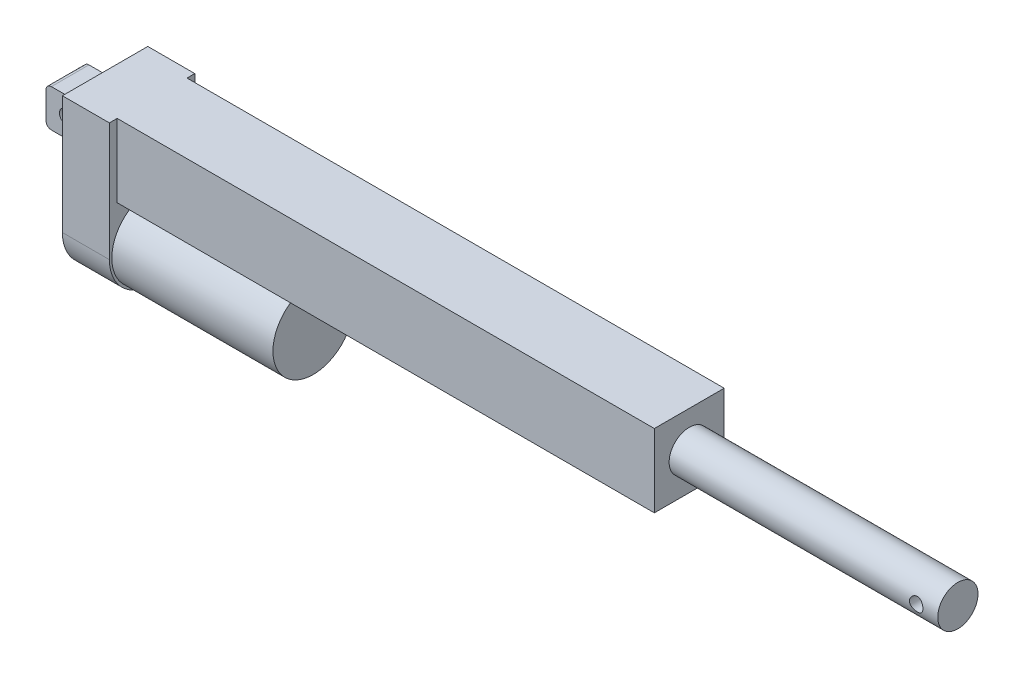
from build123d import *

# Parameters (mm, degrees)
SKETCH1_R               = 9.525
BOSS_EXTRUDE1_DEPTH     = 127
CUT_EXTRUDE1_DEPTH      = 128.712377043
CUT_EXTRUDE1_DEPTH_BACK = 128.712377043
SKETCH2_R               = 3.175
SKETCH3_W               = 33.02
SKETCH3_H               = 34.544
BOSS_EXTRUDE2_DEPTH     = 254
BOSS_EXTRUDE3_DEPTH     = 22.225
SKETCH5_R               = 19.05
BOSS_EXTRUDE4_DEPTH     = 76.2
SKETCH6_W               = 19.05
SKETCH6_H               = 17.78
SKETCH6_R               = 3.175
BOSS_EXTRUDE5_DEPTH     = 8.89
FILLET1_R               = 2.54


with BuildPart() as part:
    # Sketch1 → Boss-Extrude1 (new body)
    with BuildSketch(Plane(origin=(0, 0, 0), x_dir=(0, 0, -1), z_dir=(1, 0, 0))):
        Circle(SKETCH1_R)
    extrude(amount=BOSS_EXTRUDE1_DEPTH)

    # Sketch2 → Cut-Extrude1 (cut, two sides: drawn at the far end of the back side and taken through both)
    with BuildSketch(Plane.XY.offset(-CUT_EXTRUDE1_DEPTH_BACK)):
        with Locations((116.84, 0)):
            Circle(SKETCH2_R)
    extrude(amount=CUT_EXTRUDE1_DEPTH + CUT_EXTRUDE1_DEPTH_BACK, mode=Mode.SUBTRACT)

    # Sketch3 → Boss-Extrude2 (add)
    with BuildSketch(Plane.ZY):
        Rectangle(SKETCH3_W, SKETCH3_H)
    extrude(amount=BOSS_EXTRUDE2_DEPTH)

    # Sketch4 → Boss-Extrude3 (add)
    with BuildSketch(Plane.ZY.offset(254)):
        with BuildLine():
            Line((-20.193, 17.272), (20.193, 17.272))
            Line((20.193, 17.272), (20.193, -38.735))
            ThreePointArc((20.193, -38.735), (0, -58.928), (-20.193, -38.735))
            Line((-20.193, -38.735), (-20.193, 17.272))
        make_face()
    extrude(amount=BOSS_EXTRUDE3_DEPTH)

    # Sketch5 → Boss-Extrude4 (add)
    with BuildSketch(Plane(origin=(-254, 0, 0), x_dir=(0, 0, -1), z_dir=(1, 0, 0))):
        with Locations((0, -38.735)):
            Circle(SKETCH5_R)
    extrude(amount=BOSS_EXTRUDE4_DEPTH)

    # Sketch6 → Boss-Extrude5 (add, symmetric)
    with BuildSketch(Plane.XY):
        with Locations((-285.75, -1.778)):
            Rectangle(SKETCH6_W, SKETCH6_H)
        with Locations((-285.75, -1.778)):
            Circle(SKETCH6_R, mode=Mode.SUBTRACT)
    extrude(amount=BOSS_EXTRUDE5_DEPTH, both=True)

    # Fillet1
    fillet1_edges = [part.edges().sort_by_distance(p)[0] for p in [
        (-276.225, -10.668, 0),
        (-276.225, -1.778, -8.89),
        (-276.225, -1.778, 8.89),
        (-276.225, 7.112, 0),
        (-295.275, -10.668, 0),
        (-295.275, 7.112, 0),
    ]]
    fillet(fillet1_edges, radius=FILLET1_R)


solid = part.part
